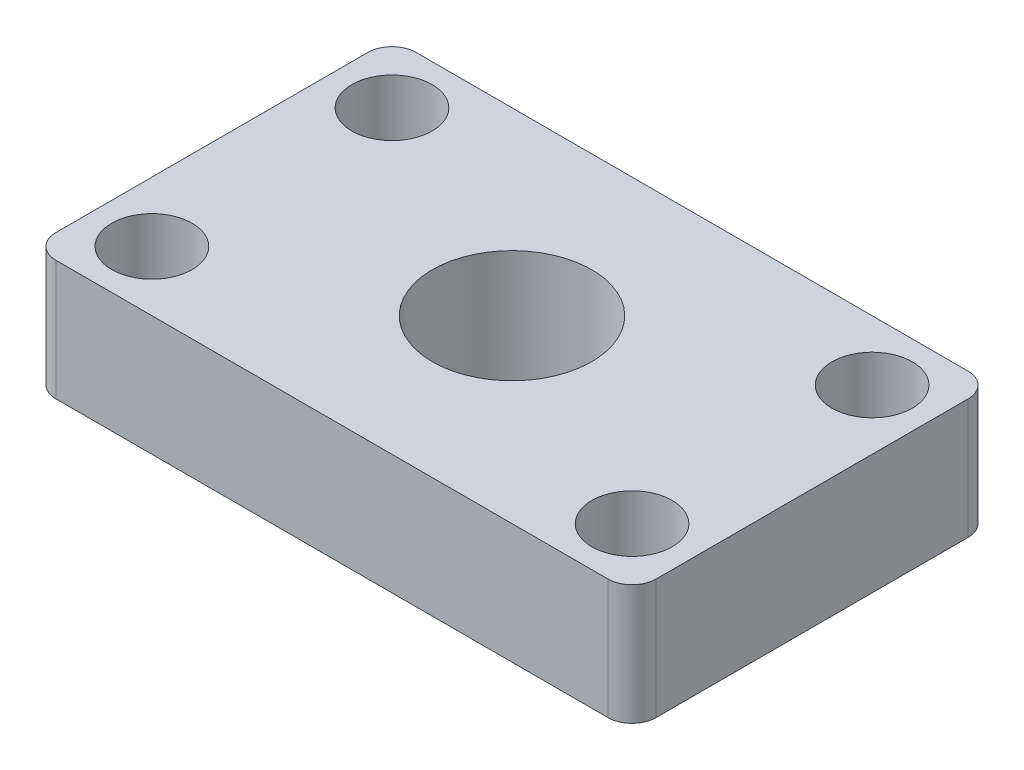
from build123d import *

# Parameters (mm, degrees)
SKETCH1_W                 = 50
SKETCH1_H                 = 30
SKETCH1_R                 = 3.35
BOSS_EXTRUDE2_DEPTH       = 10
F_8_32_TAPPED_HOLE3_D     = 3.4544
F_8_32_TAPPED_HOLE3_DEPTH = 5
F_8_32_TAPPED_HOLE3_TIP   = 1.037806461
FILLET3_R                 = 2
FILLET4_R                 = 2
F_0_535_40_TAPPED_HOLE2_D = 13.2842


with BuildPart() as part:
    # Sketch1 → Boss-Extrude2 (new body)
    with BuildSketch(Plane(origin=(0, 0, 0), x_dir=(1, 0, 0), z_dir=(0, 1, 0))):
        Rectangle(SKETCH1_W, SKETCH1_H)
        with Locations((-20, 10)):
            Circle(SKETCH1_R, mode=Mode.SUBTRACT)
        with Locations((20, 10)):
            Circle(SKETCH1_R, mode=Mode.SUBTRACT)
        with Locations((-20, -10)):
            Circle(SKETCH1_R, mode=Mode.SUBTRACT)
        with Locations((20, -10)):
            Circle(SKETCH1_R, mode=Mode.SUBTRACT)
    extrude(amount=BOSS_EXTRUDE2_DEPTH)

    # #8-32 Tapped Hole3
    with Locations(Plane(origin=(0, 5, -15), x_dir=(-1, 0, 0), z_dir=(0, 0, -1))):
        with Locations((0, 0)):
            Hole(F_8_32_TAPPED_HOLE3_D / 2, depth=F_8_32_TAPPED_HOLE3_DEPTH)
            with Locations((0, 0, -(F_8_32_TAPPED_HOLE3_DEPTH + F_8_32_TAPPED_HOLE3_TIP / 2))):  # 118° drill point
                Cone(0, F_8_32_TAPPED_HOLE3_D / 2, F_8_32_TAPPED_HOLE3_TIP, mode=Mode.SUBTRACT)

    # Fillet3
    fillet3_edges = [part.edges().sort_by_distance(p)[0] for p in [
        (-25, 5, -15),
        (25, 5, 15),
        (25, 5, -15),
    ]]
    fillet(fillet3_edges, radius=FILLET3_R)

    # Fillet4
    fillet4_edges = [part.edges().sort_by_distance(p)[0] for p in [
        (-25, 5, 15),
    ]]
    fillet(fillet4_edges, radius=FILLET4_R)

    # 0.535-40 Tapped Hole2 (through all)
    with Locations(Plane.ZX.offset(10)):
        with Locations((0, 0)):
            Hole(F_0_535_40_TAPPED_HOLE2_D / 2)


solid = part.part
